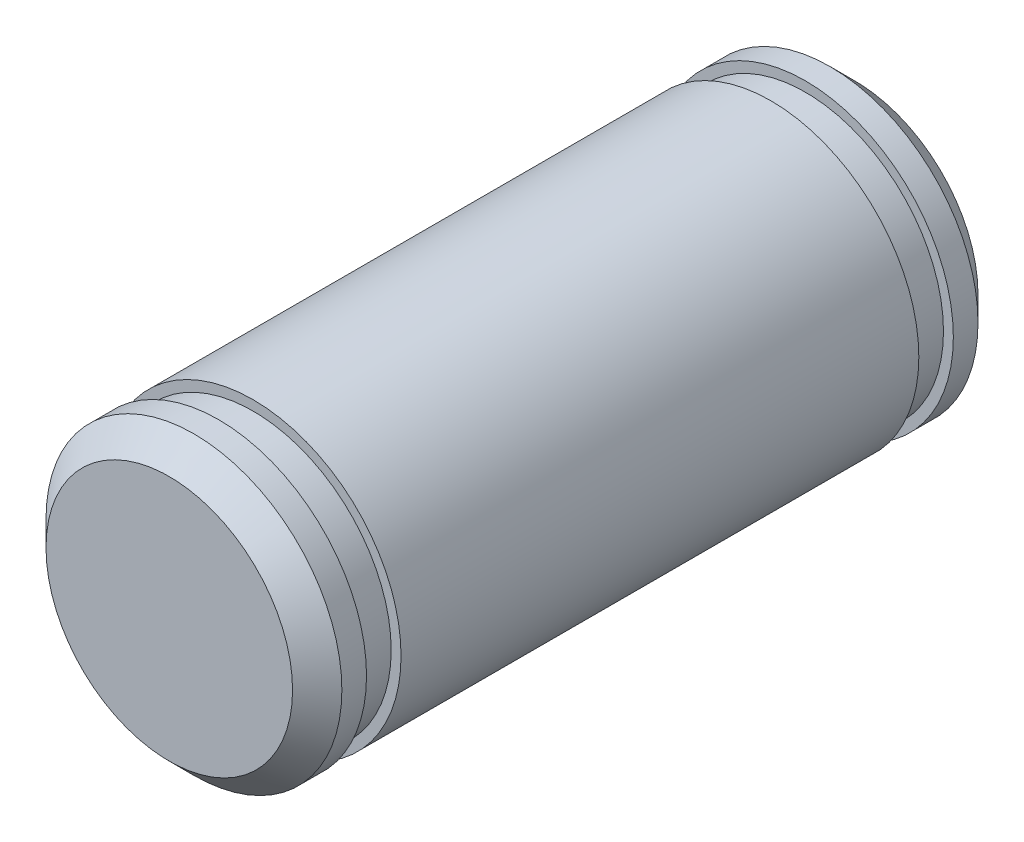
from build123d import *

# Parameters (mm, degrees)
SZKIC1_R                    = 3
DODANIE_WYCI_GNI_CIE1_DEPTH = 13.9
SFAZOWANIE1_SIZE            = 0.5
WYTNIJ_WYCI_GNI_CIE1_START  = -1.7
SZKIC2_R                    = 3
SZKIC2_R_2                  = 2.8
WYTNIJ_WYCI_GNI_CIE1_DEPTH  = 0.7
WYTNIJ_WYCI_GNI_CIE2_START  = -1
SZKIC3_R                    = 3
SZKIC3_R_2                  = 2.8
WYTNIJ_WYCI_GNI_CIE2_DEPTH  = 0.7


with BuildPart() as part:
    # Szkic1 → Dodanie-wyciągnięcie1 (new body)
    with BuildSketch(Plane.XY):
        Circle(SZKIC1_R)
    extrude(amount=DODANIE_WYCI_GNI_CIE1_DEPTH)

    # Sfazowanie1
    sfazowanie1_edges = [part.edges().sort_by_distance(p)[0] for p in [
        (-3, 0, 0),
        (-3, 0, 13.9),
    ]]
    chamfer(sfazowanie1_edges, length=SFAZOWANIE1_SIZE)

    # Szkic2 → Wytnij-wyciągnięcie1 (cut)
    with BuildSketch(Plane.XY.offset(13.9).offset(WYTNIJ_WYCI_GNI_CIE1_START)):
        Circle(SZKIC2_R)
        Circle(SZKIC2_R_2, mode=Mode.SUBTRACT)
    extrude(amount=WYTNIJ_WYCI_GNI_CIE1_DEPTH, mode=Mode.SUBTRACT)

    # Szkic3 → Wytnij-wyciągnięcie2 (cut)
    with BuildSketch(Plane(origin=(0, 0, 0), x_dir=(-1, 0, 0), z_dir=(0, 0, -1)).offset(WYTNIJ_WYCI_GNI_CIE2_START)):
        Circle(SZKIC3_R)
        Circle(SZKIC3_R_2, mode=Mode.SUBTRACT)
    extrude(amount=-WYTNIJ_WYCI_GNI_CIE2_DEPTH, mode=Mode.SUBTRACT)


solid = part.part
